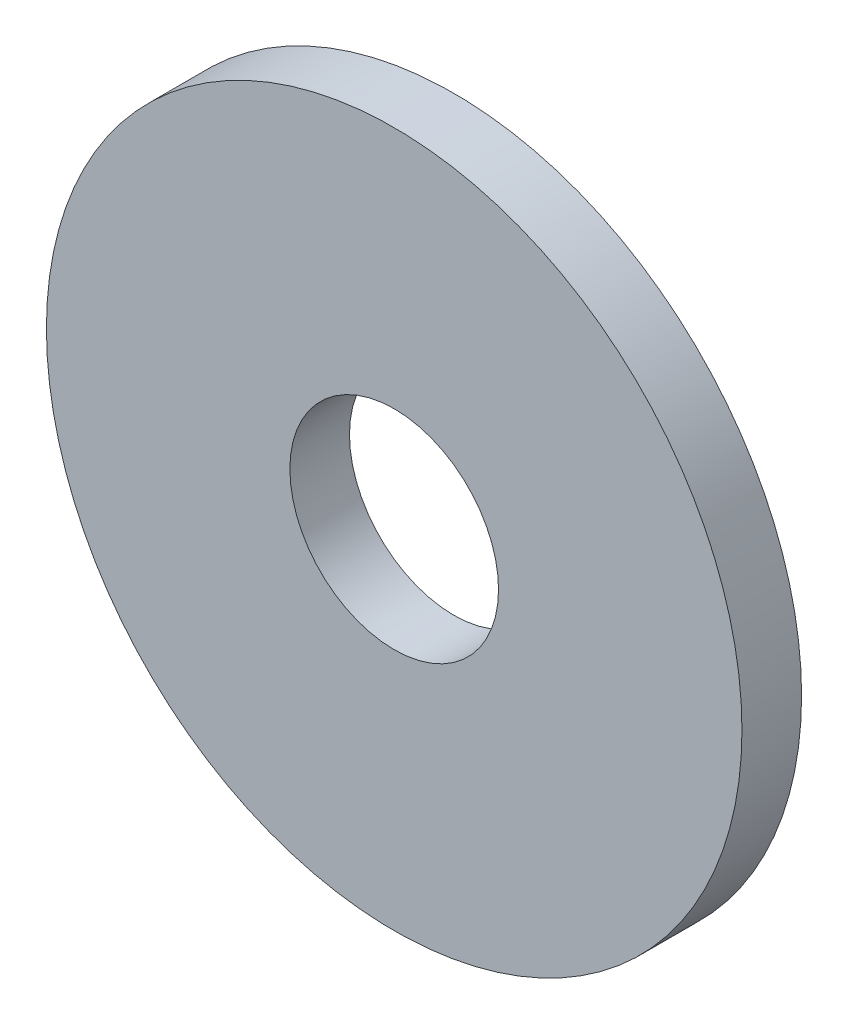
from build123d import *

# Parameters (mm, degrees)
SKETCH_1_R             = 17.5
SKETCH_1_R_2           = 5.25
SM_BASE_FLANGE_1_DEPTH = 3


# Sheet-metal steps are written as plain solids
with BuildPart() as part:
    # Sketch 1 → Базовая кромка1 (new body)
    with BuildSketch(Plane.XY):
        with Locations((0, -155.807573628)):
            Circle(SKETCH_1_R)
        with Locations((0, -155.807573628)):
            Circle(SKETCH_1_R_2, mode=Mode.SUBTRACT)
    extrude(amount=SM_BASE_FLANGE_1_DEPTH)


solid = part.part
